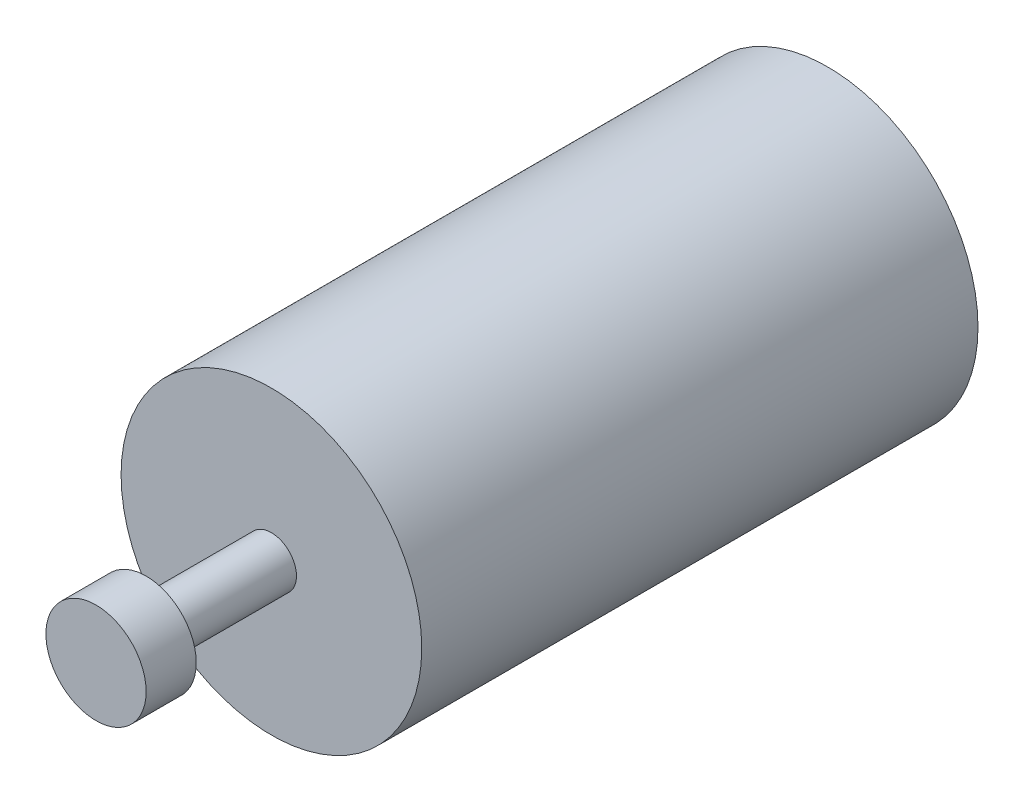
from build123d import *

# Parameters (mm, degrees)
SKETCH1_R           = 6.35
BOSS_EXTRUDE1_DEPTH = 6.35
SKETCH2_R           = 38.1
BOSS_EXTRUDE2_DEPTH = 140.97
SKETCH3_R           = 6.35
BOSS_EXTRUDE3_DEPTH = 31.75
SKETCH4_R           = 12.7
BOSS_EXTRUDE4_DEPTH = 12.7


with BuildPart() as part:
    # Sketch1 → Boss-Extrude1 (new body)
    with BuildSketch(Plane.XY):
        Circle(SKETCH1_R)
    extrude(amount=BOSS_EXTRUDE1_DEPTH)

    # Sketch2 → Boss-Extrude2 (add)
    with BuildSketch(Plane.XY.offset(6.35)):
        Circle(SKETCH2_R)
    extrude(amount=BOSS_EXTRUDE2_DEPTH)

    # Sketch3 → Boss-Extrude3 (add)
    with BuildSketch(Plane.XY.offset(147.32)):
        Circle(SKETCH3_R)
    extrude(amount=BOSS_EXTRUDE3_DEPTH)

    # Sketch4 → Boss-Extrude4 (add)
    with BuildSketch(Plane.XY.offset(179.07)):
        Circle(SKETCH4_R)
    extrude(amount=BOSS_EXTRUDE4_DEPTH)


solid = part.part
